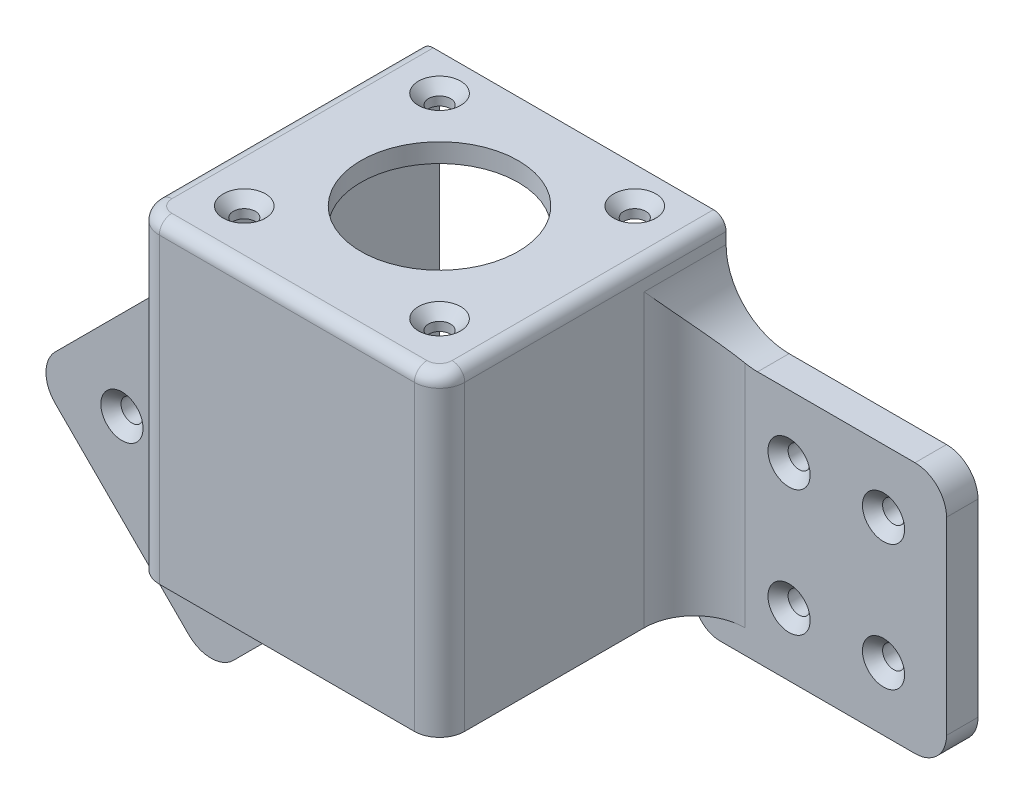
from build123d import *

# Parameters (mm, degrees)
SKETCH1_W           = 48.5
SKETCH1_H           = 45.5
BOSS_EXTRUDE1_DEPTH = 3
BOSS_EXTRUDE2_DEPTH = 47
SKETCH3_W           = 5
SKETCH3_H           = 40
BOSS_EXTRUDE3_DEPTH = 40
BOSS_EXTRUDE4_DEPTH = 5
FILLET1_R           = 8
SKETCH5_R           = 1.75
SKETCH5_R_2         = 12.5
CUT_EXTRUDE1_DEPTH  = 128.550617748
SKETCH7_R           = 1.75
CUT_EXTRUDE2_DEPTH  = 132.610590713
FILLET2_START       = -21.25
FILLET2_DEPTH       = 13
FILLET2_2_DEPTH     = 5
FILLET2_START_2     = -16.7781
FILLET2_3_DEPTH     = 8.5281
FILLET2_START_3     = -47.0000001
FILLET2_4_DEPTH     = 46.2000001
FILLET3_R           = 5
FILLET4_R           = 2
CHAMFER2_SIZE       = 1.6
FILLET5_R           = 4
FILLET7_R           = 4
FILLET8_R           = 2
CUT_EXTRUDE3_REACH  = 133.064
SKETCH8_W           = 10
SKETCH8_H           = 10
FILLET9_R           = 2
CHAMFER3_SIZE       = 1.6


with BuildPart() as part:
    # Sketch1 → Boss-Extrude1 (new body)
    with BuildSketch(Plane(origin=(0, 0, 0), x_dir=(1, 0, 0), z_dir=(0, 1, 0))):
        with Locations((0, -1.5)):
            Rectangle(SKETCH1_W, SKETCH1_H)
    extrude(amount=BOSS_EXTRUDE1_DEPTH)

    # Sketch2 → Boss-Extrude2 (add)
    with BuildSketch(Plane.XZ):
        Polygon((-21.25, 21.25), (21.25, 21.25), (21.25, -21.25), (24.25, -21.25), (24.25, 24.25), (-24.25, 24.25), (-24.25, -21.25), (-21.25, -21.25), align=None)
    extrude(amount=BOSS_EXTRUDE2_DEPTH)

    # Sketch3 → Boss-Extrude3 (add)
    with BuildSketch(Plane(origin=(24.25, 0, 0), x_dir=(0, 0, -1), z_dir=(1, 0, 0))):
        with Locations((18.75, -30.8)):
            Rectangle(SKETCH3_W, SKETCH3_H)
    extrude(amount=BOSS_EXTRUDE3_DEPTH)

    # Sketch4 → Boss-Extrude4 (add)
    with BuildSketch(Plane(origin=(0, 0, -21.25), x_dir=(-1, 0, 0), z_dir=(0, 0, -1))):
        Polygon((24.25, -10.8), (80.818542495, -67.368542495), (52.534271247, -95.652813742), (24.25, -67.368542495), align=None)
    extrude(amount=-BOSS_EXTRUDE4_DEPTH)

    # Fillet1
    fillet1_edges = [part.edges().sort_by_distance(p)[0] for p in [
        (24.25, -28.9, -16.25),
        (-24.25, -28.9, -16.25),
    ]]
    fillet(fillet1_edges, radius=FILLET1_R)

    # Sketch5 → Cut-Extrude1 (cut, through all)
    with BuildSketch(Plane.XZ):
        with Locations(Location((-15.5, 15.5, 0), (0, 0, 270))):
            Circle(SKETCH5_R)
        with Locations(Location((15.5, 15.5, 0), (0, 0, 270))):
            Circle(SKETCH5_R)
        with Locations(Location((15.5, -15.5, 0), (0, 0, 270))):
            Circle(SKETCH5_R)
        with Locations(Location((-15.5, -15.5, 0), (0, 0, 270))):
            Circle(SKETCH5_R)
        with Locations(Location((0, 0, 0), (0, 0, 270))):
            Circle(SKETCH5_R_2)
    extrude(amount=-CUT_EXTRUDE1_DEPTH, mode=Mode.SUBTRACT)

    # Sketch7 → Cut-Extrude2 (cut, through all)
    with BuildSketch(Plane.XY.offset(-16.25)):
        with Locations((54.25, -20.8)):
            Circle(SKETCH7_R)
        with Locations((54.25, -40.8)):
            Circle(SKETCH7_R)
        with Locations((-66.676406871, -67.368542495)):
            Circle(SKETCH7_R)
        with Locations((-52.534271247, -81.510678119)):
            Circle(SKETCH7_R)
        with Locations((-45.463203436, -46.155339059)):
            Circle(SKETCH7_R)
        with Locations((-31.321067812, -60.297474683)):
            Circle(SKETCH7_R)
        with Locations((39.25, -20.8)):
            Circle(SKETCH7_R)
        with Locations((39.25, -40.8)):
            Circle(SKETCH7_R)
    extrude(amount=-CUT_EXTRUDE2_DEPTH, mode=Mode.SUBTRACT)

    # Fillet2: read off the stored shape, not the designer's step
    # Fillet2 outline → Fillet2 (add)
    with BuildSketch(Plane.XY.offset(FILLET2_START)):
        with BuildLine():
            Line((24.25, -10.8), (34.25, -10.8))
            ThreePointArc((34.25, -10.8), (27.178932188, -7.871067812), (24.25, -0.8))
            Line((24.25, -0.8), (24.25, -10.8))
        make_face()
    extrude(amount=FILLET2_DEPTH)

    # Fillet2 2 outline → Fillet2 2 (add)
    with BuildSketch(Plane.XY.offset(FILLET2_START)):
        with BuildLine():
            Line((-27.178932188, -13.728932188), (-24.25, -10.8))
            Line((-24.25, -10.8), (-24.25, -6.657864376))
            ThreePointArc((-24.25, -6.657864376), (-25.011204675, -10.4846987), (-27.178932188, -13.728932188))
        make_face()
        with BuildLine():
            ThreePointArc((-24.25, -54.141428429), (-23.469544457, -50.268445083), (-21.25, -47))
            Line((-21.25, -47), (-24.25, -47))
            Line((-24.25, -47), (-24.25, -54.141428429))
        make_face()
    extrude(amount=FILLET2_2_DEPTH)

    # Fillet2 3 outline → Fillet2 3 (add)
    with BuildSketch(Plane.XY.offset(FILLET2_START_2)):
        with BuildLine():
            Line((-27.178932188, -13.728932188), (-24.25, -10.8))
            Line((-24.25, -10.8), (-24.25, -6.657864376))
            ThreePointArc((-24.25, -6.657864376), (-25.011204675, -10.4846987), (-27.178932188, -13.728932188))
        make_face()
    extrude(amount=FILLET2_3_DEPTH)

    # Fillet2 4 outline → Fillet2 4 (cut)
    with BuildSketch(Plane(origin=(0, 0, 0), x_dir=(1, 0, 0), z_dir=(0, 1, 0)).offset(FILLET2_START_3)):
        with BuildLine():
            Line((36, 16.250000001), (32.25, 16.25))
            ThreePointArc((32.25, 16.25), (26.593145751, 13.906854249), (24.25, 8.25))
            Line((24.25, 8.25), (36, 8.25))
            Line((36, 8.25), (36, 16.250000001))
        make_face()
        with BuildLine():
            ThreePointArc((-24.25, 8.25), (-25.541796068, 12.608898943), (-29, 15.560095758))
            Line((-29, 15.560095758), (-29, 8.25))
            Line((-29, 8.25), (-24.25, 8.25))
        make_face()
    extrude(amount=FILLET2_4_DEPTH, mode=Mode.SUBTRACT)

    # Fillet3
    fillet3_edges = [part.edges().sort_by_distance(p)[0] for p in [
        (64.25, -10.8, -18.75),
        (64.25, -50.8, -18.75),
        (-24.25, -67.368542495, -18.75),
        (-80.818542495, -67.368542495, -18.75),
        (-52.534271247, -95.652813742, -18.75),
    ]]
    fillet(fillet3_edges, radius=FILLET3_R)

    # Fillet4
    fillet4_edges = [part.edges().sort_by_distance(p)[0] for p in [
        (-21.25, -23.5, 21.25),
        (21.25, -23.5, 21.25),
    ]]
    fillet(fillet4_edges, radius=FILLET4_R)

    # Chamfer2
    chamfer2_edges = [part.edges().sort_by_distance(p)[0] for p in [
        (-15.5, 3, -13.75),
        (15.5, 3, -13.75),
        (15.5, 3, 17.25),
        (-15.5, 3, 17.25),
    ]]
    chamfer(chamfer2_edges, length=CHAMFER2_SIZE)

    # Fillet5
    # the kernel refuses this fillet: 4 mm, written as the material it takes off along each edge
    with BuildSketch(Plane(origin=(24.25, -50.8, -6.262507822), x_dir=(1, 0, 0), z_dir=(0, 0, -1))) as fillet5_piece_1:
        with BuildLine():
            CenterArc((3.994996871, -4), FILLET5_R, 90, 87.134016017)
            Line((0, -3.8), (-0.079899937, -3.796))
            ThreePointArc((-0.079899937, -3.796), (-0.08, -1.9), (-0.08, 0))
            Line((-0.08, 0), (0, 0.08))
            Line((0, 0.08), (3.994996871, 0.08))
            Line((3.994996871, 0.08), (3.994996871, 0))
        make_face()
    extrude(amount=24.974984355, mode=Mode.SUBTRACT)

    # Fillet7
    fillet7_edges = [part.edges().sort_by_distance(p)[0] for p in [
        (24.25, -22, 24.25),
        (-24.25, -22, 24.25),
    ]]
    fillet(fillet7_edges, radius=FILLET7_R)

    # Fillet8
    fillet8_edges = [part.edges().sort_by_distance(p)[0] for p in [
        (24.25, 3, -0.5),
        (0, 3, 24.25),
        (-23.078427125, 3, 23.078427125),
        (23.078427125, 3, 23.078427125),
        (-24.25, 3, -0.5),
    ]]
    fillet(fillet8_edges, radius=FILLET8_R)

    # Sketch8 → Cut-Extrude3 (cut, up to next)
    with BuildSketch(Plane.ZY.offset(24.25), mode=Mode.PRIVATE) as cut_extrude3_sk1:
        with Locations((0, -42)):
            Rectangle(SKETCH8_W, SKETCH8_H)
    cut_extrude3_tool1 = extrude(cut_extrude3_sk1.sketch, amount=-CUT_EXTRUDE3_REACH, mode=Mode.PRIVATE) & part.part
    add(cut_extrude3_tool1.solids().sort_by_distance((-24.25, -42, 0))[0], mode=Mode.SUBTRACT)

    # Fillet9
    fillet9_edges = [part.edges().sort_by_distance(p)[0] for p in [
        (-22.75, -47, -5),
        (-22.75, -37, -5),
        (-22.75, -37, 5),
        (-22.75, -47, 5),
    ]]
    fillet(fillet9_edges, radius=FILLET9_R)

    # Chamfer3
    chamfer3_edges = [part.edges().sort_by_distance(p)[0] for p in [
        (-54.284271247, -81.510678119, -16.25),
        (-47.213203436, -46.155339059, -16.25),
        (-68.426406871, -67.368542495, -16.25),
        (52.5, -40.8, -16.25),
        (37.5, -40.8, -16.25),
        (37.5, -20.8, -16.25),
        (-33.071067812, -60.297474683, -16.25),
        (52.5, -20.8, -16.25),
    ]]
    chamfer(chamfer3_edges, length=CHAMFER3_SIZE)


solid = part.part
